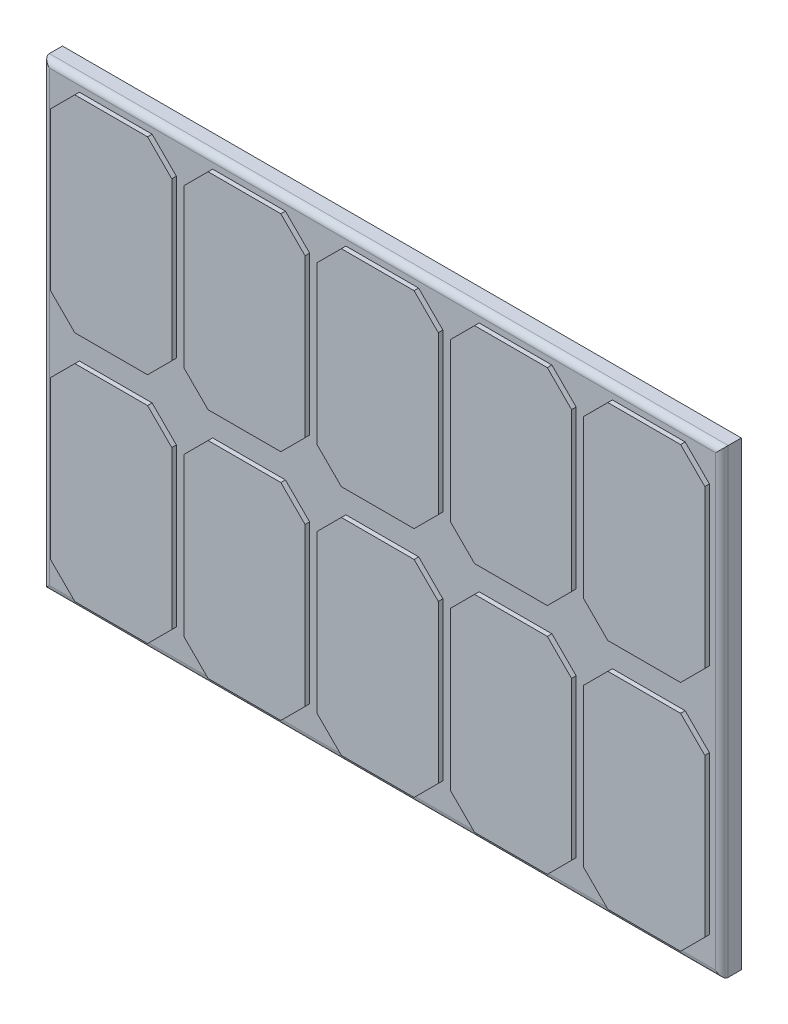
from build123d import *

# Parameters (mm, degrees)
SKETCH1_W                   = 88.9
SKETCH1_H                   = 60.325
SOLARPANELPLASTICBASE_DEPTH = 2.54
CRYSTALELEMENT_DEPTH        = 0.5969
OUTSIDEFILLET_R             = 0.8255
LPATTERN1_COUNT             = 5
LPATTERN1_PITCH             = 17.4498
LPATTERN1_COUNT_DIR2        = 2
LPATTERN1_PITCH_DIR2        = 30.48


with BuildPart() as part:
    # Sketch1 → SolarPanelPlasticBase (new body)
    with BuildSketch(Plane.XY):
        Rectangle(SKETCH1_W, SKETCH1_H)
    extrude(amount=SOLARPANELPLASTICBASE_DEPTH)

    # Sketch2 → CrystalElement (add)
    with BuildSketch(Plane.XY.offset(2.54)):
        Polygon((-39.6875, 28.575), (-30.1625, 28.575), (-26.9875, 25.4), (-26.9875, 4.7625), (-30.1625, 1.5875), (-39.6875, 1.5875), (-42.8625, 4.7625), (-42.8625, 25.4), align=None)
    crystalelement = extrude(amount=CRYSTALELEMENT_DEPTH)

    # OutsideFillet
    outsidefillet_edges = [part.edges().sort_by_distance(p)[0] for p in [
        (0, -30.1625, 2.54),
        (44.45, 0, 2.54),
        (-44.45, 0, 2.54),
        (0, 30.1625, 2.54),
    ]]
    fillet(outsidefillet_edges, radius=OUTSIDEFILLET_R)

    # LPattern1: CrystalElement 5 × 2
    with Locations(*[(i * LPATTERN1_PITCH, -j * LPATTERN1_PITCH_DIR2, 0) for i in range(LPATTERN1_COUNT) for j in range(LPATTERN1_COUNT_DIR2) if (i, j) != (0, 0)]):
        add(crystalelement)


solid = part.part
